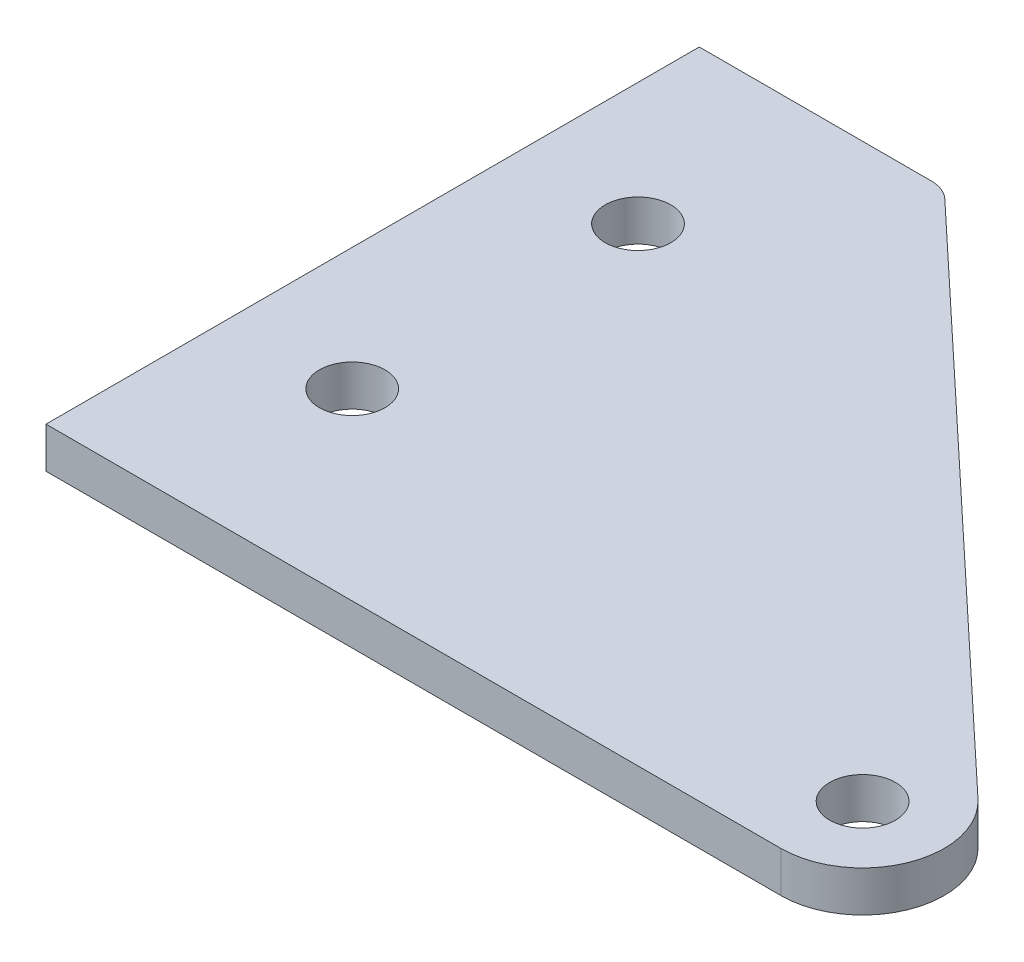
from build123d import *

# Parameters (mm, degrees)
BOSS_EXTRUDE1_DEPTH     = 3.175
F_1_4_20_TAPPED_HOLE1_D = 5.1054
F_1_4_20_TAPPED_HOLE2_D = 5.1054
FILLET1_R               = 2.54


with BuildPart() as part:
    # Sketch1 → Boss-Extrude1 (new body)
    with BuildSketch(Plane(origin=(0, 0, 0), x_dir=(1, 0, 0), z_dir=(0, 1, 0))):
        with BuildLine():
            Line((0, 0), (0, 50.8))
            Line((0, 50.8), (19.05, 50.8))
            Line((19.05, 50.8), (61.494599756, 10.981085505))
            ThreePointArc((61.494599756, 10.981085505), (63.054654645, 4.013859268), (57.15, 0))
            Line((57.15, 0), (0, 0))
        make_face()
    extrude(amount=BOSS_EXTRUDE1_DEPTH)

    # 1/4-20 Tapped Hole1 (through all)
    with Locations(Plane(origin=(0, 0, 0), x_dir=(-1, 0, 0), z_dir=(0, -1, 0))):
        with Locations((-57.15, 6.35)):
            Hole(F_1_4_20_TAPPED_HOLE1_D / 2)

    # 1/4-20 Tapped Hole2 (through all)
    with Locations(Plane(origin=(0, 3.175, 0), x_dir=(1, 0, 0), z_dir=(0, 1, 0))):
        with Locations((9.525, 36.5125), (9.525, 14.2875)):
            Hole(F_1_4_20_TAPPED_HOLE2_D / 2)

    # Fillet1
    fillet1_edges = [part.edges().sort_by_distance(p)[0] for p in [
        (19.05, 1.5875, -50.8),
    ]]
    fillet(fillet1_edges, radius=FILLET1_R)


solid = part.part
